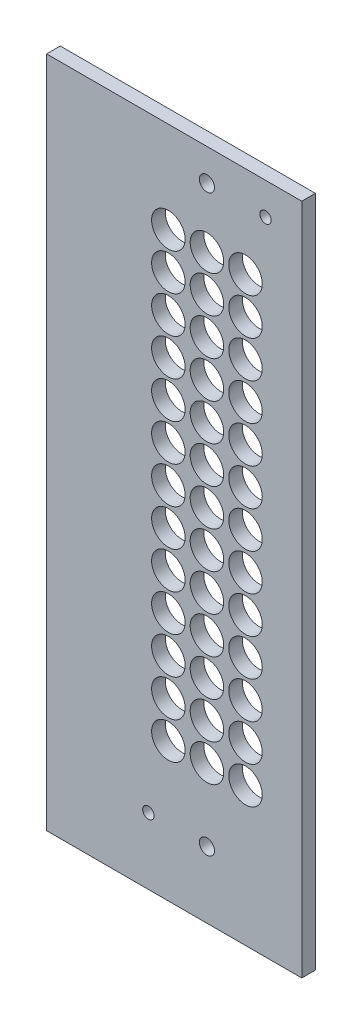
from build123d import *

# Parameters (mm, degrees)
BOSS_EXTRUDE1_OUTLINE_W                         = 56.55
BOSS_EXTRUDE1_OUTLINE_H                         = 197.425
BOSS_EXTRUDE1_DEPTH                             = 4.064
SKETCH4_R                                       = 5
CUT_EXTRUDE2_DEPTH                              = 103.762587439
LPATTERN3_COUNT                                 = 13
LPATTERN3_PITCH                                 = 11
SKETCH5_W                                       = 4.064
SKETCH5_H                                       = 197.425
BOSS_EXTRUDE2_DEPTH                             = 19.525
SKETCH14_W                                      = 76.075
SKETCH14_H                                      = 4.064
BOSS_EXTRUDE3_DEPTH                             = 3.175
M4_CLEARANCE_HOLE1_D                            = 4.5
CSK_FOR_M3_FLAT_HEAD_MACHINE_SCREW2_D           = 3.4
CSK_FOR_M3_FLAT_HEAD_MACHINE_SCREW2_CSINK_D     = 6.3
CSK_FOR_M3_FLAT_HEAD_MACHINE_SCREW2_CSINK_ANGLE = 90


# Read off the part's stored shape, not the designer's step: Boss-Extrude1
with BuildPart() as part:
    # Boss-Extrude1 outline → Boss-Extrude1 (new body)
    with BuildSketch(Plane.XY):
        Rectangle(BOSS_EXTRUDE1_OUTLINE_W, BOSS_EXTRUDE1_OUTLINE_H)
    extrude(amount=BOSS_EXTRUDE1_DEPTH)

    # Sketch4 → Cut-Extrude2 (cut, through all)
    with BuildSketch(Plane.XY.offset(4.064)):
        with Locations((0, -57.369162839)):
            Circle(SKETCH4_R)
        with Locations((11.5, -57.369162839)):
            Circle(SKETCH4_R)
        with Locations((-11.5, -57.369162839)):
            Circle(SKETCH4_R)
    cut_extrude2 = extrude(amount=-CUT_EXTRUDE2_DEPTH, mode=Mode.SUBTRACT)

    # LPattern3: Cut-Extrude2 ×13
    with Locations(*[(0, i * LPATTERN3_PITCH, 0) for i in range(1, LPATTERN3_COUNT)]):
        add(cut_extrude2, mode=Mode.SUBTRACT)

    # Sketch5 → Boss-Extrude2 (add)
    with BuildSketch(Plane.ZY.offset(28.275)):
        with Locations((2.032, 0)):
            Rectangle(SKETCH5_W, SKETCH5_H)
    extrude(amount=BOSS_EXTRUDE2_DEPTH)

    # Sketch14 → Boss-Extrude3 (add)
    with BuildSketch(Plane(origin=(0, 98.7125, 0), x_dir=(1, 0, 0), z_dir=(0, 1, 0))):
        with Locations((-9.7625, -2.032)):
            Rectangle(SKETCH14_W, SKETCH14_H)
    extrude(amount=BOSS_EXTRUDE3_DEPTH)

    # M4 Clearance Hole1 (through all)
    with Locations(Plane.XY.offset(4.064)):
        with Locations((0, 92.3625001), (0, -78.8874999)):
            Hole(M4_CLEARANCE_HOLE1_D / 2)

    # CSK for M3 Flat Head Machine Screw2 (through all)
    with Locations(Plane(origin=(0, 0, 0), x_dir=(-1, 0, 0), z_dir=(0, 0, -1))):
        with Locations((17.4625, -78.8874999), (-17.4625, 92.3625001)):
            CounterSinkHole(CSK_FOR_M3_FLAT_HEAD_MACHINE_SCREW2_D / 2, CSK_FOR_M3_FLAT_HEAD_MACHINE_SCREW2_CSINK_D / 2, counter_sink_angle=CSK_FOR_M3_FLAT_HEAD_MACHINE_SCREW2_CSINK_ANGLE)


solid = part.part
